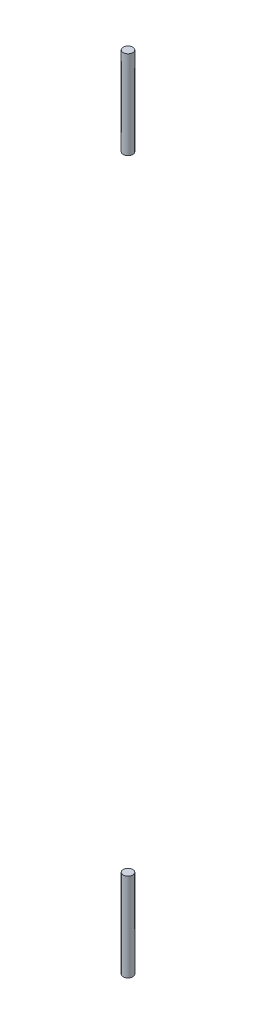
from build123d import *

# Parameters (mm, degrees)
BOSS_EXTRUDE1_OUTLINE_R = 3.175
BOSS_EXTRUDE1_DEPTH     = 58.499950175
SKETCH1_R               = 3.175
BOSS_EXTRUDE2_DEPTH     = 58.499950175


# Read off the part's stored shape, not the designer's step: Boss-Extrude1
with BuildPart() as part:
    # Boss-Extrude1 outline → Boss-Extrude1 (new body)
    with BuildSketch(Plane(origin=(0, 221.304262336, 0), x_dir=(-1, 0, 0), z_dir=(0, -1, 0))):
        with Locations((-269.702081562, -21.267819308)):
            Circle(BOSS_EXTRUDE1_OUTLINE_R)
    extrude(amount=BOSS_EXTRUDE1_DEPTH)


with BuildPart() as body_2:
    # Sketch1 → Boss-Extrude2 (new body)
    with BuildSketch(Plane(origin=(0, -250.916087489, 0), x_dir=(-1, 0, 0), z_dir=(0, -1, 0))):
        with Locations(Location((-269.702081562, -21.267819308, 0), (0, 0, 90))):
            Circle(SKETCH1_R)
    extrude(amount=BOSS_EXTRUDE2_DEPTH)


solid = Compound([part.part, body_2.part])
